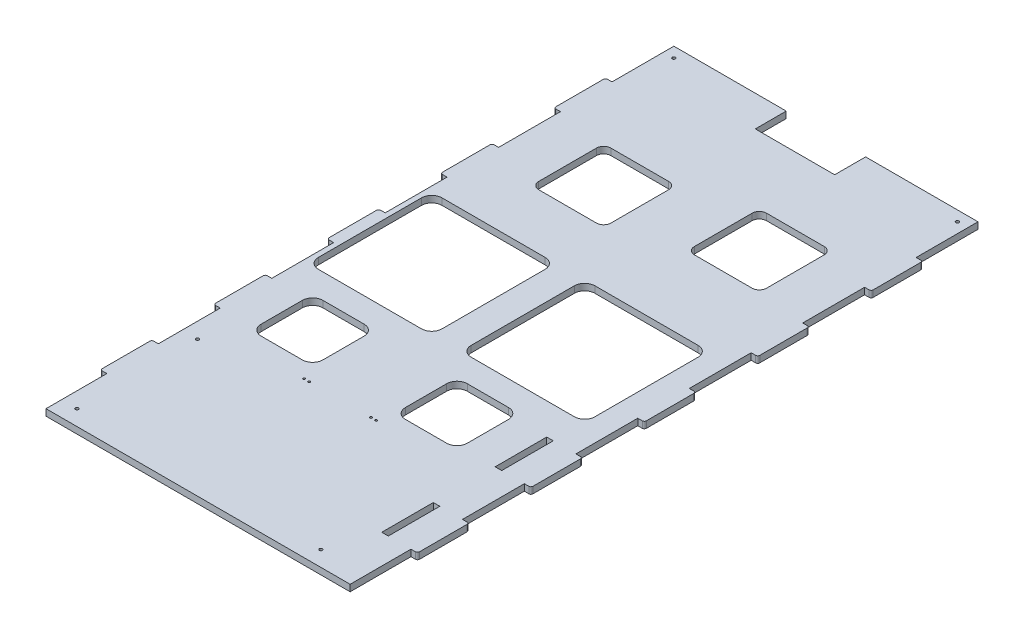
from build123d import *

# Parameters (mm, degrees)
BOSS_EXTRUDE1_DEPTH = 6.35
FILLET1_R           = 2
SKETCH2_R           = 1.5
SKETCH2_R_2         = 1.025
SKETCH2_W           = 6.35
SKETCH2_H           = 50
SKETCH2_W_2         = 120
SKETCH2_H_2         = 120
SKETCH2_W_3         = 77
SKETCH2_H_3         = 30
CUT_EXTRUDE1_DEPTH  = 6.35
FILLET2_R           = 10


with BuildPart() as part:
    # Sketch1 → Boss-Extrude1 (new body)
    with BuildSketch(Plane(origin=(0, 0, 0), x_dir=(1, 0, 0), z_dir=(0, 1, 0))):
        Polygon((0, 0), (295, 0), (295, 59), (301.35, 59), (301.35, 109), (295, 109), (295, 169), (301.35, 169), (301.35, 219), (295, 219), (295, 279), (301.35, 279), (301.35, 329), (295, 329), (295, 389), (301.35, 389), (301.35, 439), (295, 439), (295, 499), (301.35, 499), (301.35, 549), (295, 549), (295, 609), (0, 609), (0, 549), (-6.35, 549), (-6.35, 499), (0, 499), (0, 439), (-6.35, 439), (-6.35, 389), (0, 389), (0, 329), (-6.35, 329), (-6.35, 279), (0, 279), (0, 219), (-6.35, 219), (-6.35, 169), (0, 169), (0, 109), (-6.35, 109), (-6.35, 59), (0, 59), align=None)
    extrude(amount=BOSS_EXTRUDE1_DEPTH)

    # Fillet1
    fillet1_edges = [part.edges().sort_by_distance(p)[0] for p in [
        (301.35, 3.175, -549),
        (301.35, 3.175, -499),
        (301.35, 3.175, -439),
        (301.35, 3.175, -389),
        (301.35, 3.175, -329),
        (301.35, 3.175, -279),
        (301.35, 3.175, -219),
        (301.35, 3.175, -169),
        (301.35, 3.175, -109),
        (301.35, 3.175, -59),
        (-6.35, 3.175, -59),
        (-6.35, 3.175, -109),
        (-6.35, 3.175, -169),
        (-6.35, 3.175, -219),
        (-6.35, 3.175, -279),
        (-6.35, 3.175, -329),
        (-6.35, 3.175, -389),
        (-6.35, 3.175, -439),
        (-6.35, 3.175, -499),
        (-6.35, 3.175, -549),
    ]]
    fillet(fillet1_edges, radius=FILLET1_R)

    # Sketch2 → Cut-Extrude1 (cut)
    with BuildSketch(Plane(origin=(0, 6.35, 0), x_dir=(1, 0, 0), z_dir=(0, 1, 0))):
        with Locations((15, 15)):
            Circle(SKETCH2_R)
        with Locations((251.65, 15)):
            Circle(SKETCH2_R)
        with Locations((15, 131.925897501)):
            Circle(SKETCH2_R)
        with Locations((10, 599)):
            Circle(SKETCH2_R)
        with Locations((285, 599)):
            Circle(SKETCH2_R)
        with Locations((100, 150.297977664)):
            Circle(SKETCH2_R_2)
        with Locations((105, 150.297977664)):
            Circle(SKETCH2_R_2)
        with Locations((165, 150.297977664)):
            Circle(SKETCH2_R_2)
        with Locations((170, 150.297977664)):
            Circle(SKETCH2_R_2)
        with Locations((269.825, 194)):
            Rectangle(SKETCH2_W, SKETCH2_H)
        with Locations((269.825, 84)):
            Rectangle(SKETCH2_W, SKETCH2_H)
        with BuildLine():
            Line((55.042435698, 492.876808594), (111.042435698, 492.876808594))
            ThreePointArc((111.042435698, 492.876808594), (115.992183166, 490.826556062), (118.042435698, 485.876808594))
            Line((118.042435698, 485.876808594), (118.042435698, 429.876808594))
            ThreePointArc((118.042435698, 429.876808594), (115.992183166, 424.927061126), (111.042435698, 422.876808594))
            Line((111.042435698, 422.876808594), (55.042435698, 422.876808594))
            ThreePointArc((55.042435698, 422.876808594), (50.09268823, 424.927061126), (48.042435698, 429.876808594))
            Line((48.042435698, 429.876808594), (48.042435698, 485.876808594))
            ThreePointArc((48.042435698, 485.876808594), (50.09268823, 490.826556062), (55.042435698, 492.876808594))
        make_face()
        with BuildLine():
            Line((185.233522799, 513.658142081), (241.233522799, 513.658142081))
            ThreePointArc((241.233522799, 513.658142081), (246.183270267, 511.607889549), (248.233522799, 506.658142081))
            Line((248.233522799, 506.658142081), (248.233522799, 450.658142081))
            ThreePointArc((248.233522799, 450.658142081), (246.183270267, 445.708394612), (241.233522799, 443.658142081))
            Line((241.233522799, 443.658142081), (185.233522799, 443.658142081))
            ThreePointArc((185.233522799, 443.658142081), (180.283775331, 445.708394612), (178.233522799, 450.658142081))
            Line((178.233522799, 450.658142081), (178.233522799, 506.658142081))
            ThreePointArc((178.233522799, 506.658142081), (180.283775331, 511.607889549), (185.233522799, 513.658142081))
        make_face()
        with BuildLine():
            Line((43.325, 225.297977664), (83.325, 225.297977664))
            ThreePointArc((83.325, 225.297977664), (90.396067812, 222.369045476), (93.325, 215.297977664))
            Line((93.325, 215.297977664), (93.325, 175.297977664))
            ThreePointArc((93.325, 175.297977664), (90.396067812, 168.226909853), (83.325, 165.297977664))
            Line((83.325, 165.297977664), (43.325, 165.297977664))
            ThreePointArc((43.325, 165.297977664), (36.253932188, 168.226909853), (33.325, 175.297977664))
            Line((33.325, 175.297977664), (33.325, 215.297977664))
            ThreePointArc((33.325, 215.297977664), (36.253932188, 222.369045476), (43.325, 225.297977664))
        make_face()
        with Locations((65, 309.153604097)):
            Rectangle(SKETCH2_W_2, SKETCH2_H_2)
        with Locations((213, 309.452802196)):
            Rectangle(SKETCH2_W_2, SKETCH2_H_2)
        with BuildLine():
            Line((173.325, 215.297977664), (173.325, 175.297977664))
            ThreePointArc((173.325, 175.297977664), (176.253932188, 168.226909853), (183.325, 165.297977664))
            Line((183.325, 165.297977664), (223.325, 165.297977664))
            ThreePointArc((223.325, 165.297977664), (230.396067812, 168.226909853), (233.325, 175.297977664))
            Line((233.325, 175.297977664), (233.325, 215.297977664))
            ThreePointArc((233.325, 215.297977664), (230.396067812, 222.369045476), (223.325, 225.297977664))
            Line((223.325, 225.297977664), (183.325, 225.297977664))
            ThreePointArc((183.325, 225.297977664), (176.253932188, 222.369045476), (173.325, 215.297977664))
        make_face()
        with Locations((147.5, 594)):
            Rectangle(SKETCH2_W_3, SKETCH2_H_3)
    extrude(amount=-CUT_EXTRUDE1_DEPTH, mode=Mode.SUBTRACT)

    # Fillet2
    fillet2_edges = [part.edges().sort_by_distance(p)[0] for p in [
        (125, 3.175, -249.153604097),
        (5, 3.175, -249.153604097),
        (5, 3.175, -369.153604097),
        (125, 3.175, -369.153604097),
        (153, 3.175, -249.452802196),
        (273, 3.175, -249.452802196),
        (273, 3.175, -369.452802196),
        (153, 3.175, -369.452802196),
    ]]
    fillet(fillet2_edges, radius=FILLET2_R)


solid = part.part
